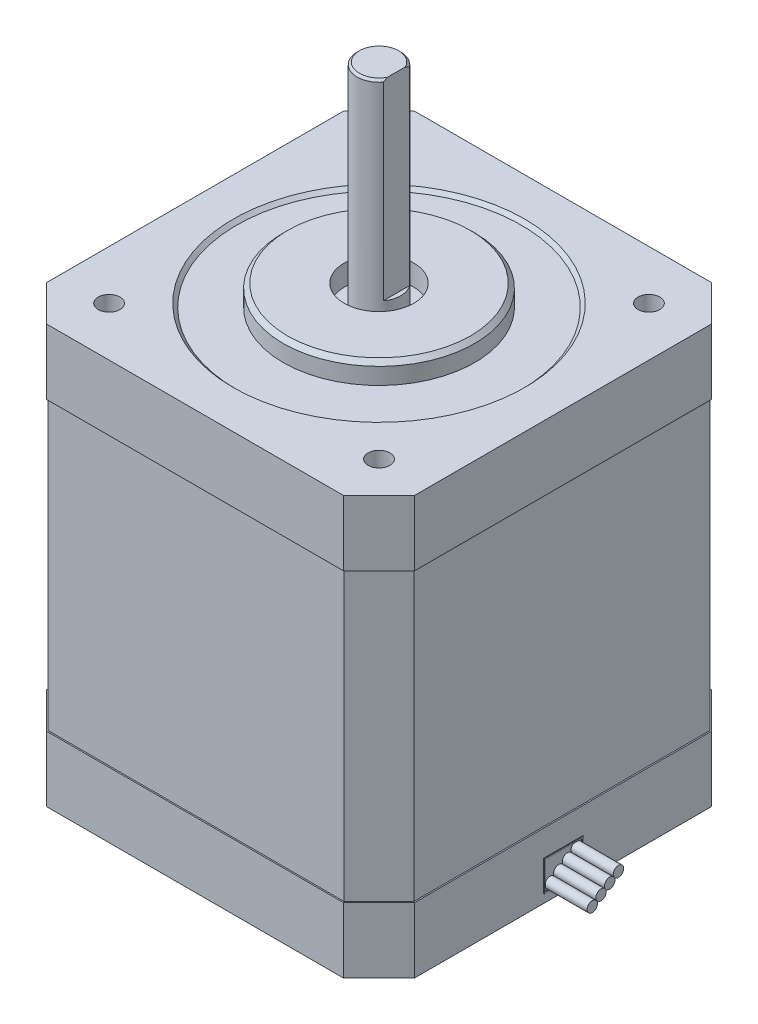
from build123d import *

# Parameters (mm, degrees)
CROQUIS1_W                          = 42
CROQUIS1_H                          = 42
SALIENTE_EXTRUIR1_DEPTH             = 48
CHAFL_N1_SIZE                       = 4
CROQUIS3_R                          = 16.25
CORTAR_EXTRUIR1_DEPTH               = 0.4
SALIENTE_EXTRUIR2_REACH             = 60.155
CROQUIS4_R                          = 11
CROQUIS4_R_2                        = 4
CHAFL_N2_SIZE                       = 0.5
CROQUIS5_R                          = 2.5
SALIENTE_EXTRUIR3_DEPTH             = 22
SALIENTE_EXTRUIR3_DIRECTION_2_REACH = 60.155
CORTAR_EXTRUIR2_DEPTH               = 22
CHAFL_N3_SIZE                       = 0.25
SALIENTE_EXTRUIR9_DEPTH             = 7.5
SALIENTE_EXTRUIR10_DEPTH            = 7.5
CROQUIS7_R                          = 1.25
CORTAR_EXTRUIR3_DEPTH               = 4.5
CROQUIS10_W                         = 4.5
CROQUIS10_H                         = 3.5
CROQUIS10_W_2                       = 4.2
CROQUIS10_H_2                       = 3.2
SALIENTE_EXTRUIR7_DEPTH             = 0.1
CROQUIS11_R                         = 0.600632734
SALIENTE_EXTRUIR8_DEPTH             = 5
SALIENTE_EXTRUIR8_2_DEPTH           = 5
SALIENTE_EXTRUIR8_3_DEPTH           = 5
SALIENTE_EXTRUIR8_4_DEPTH           = 5


with BuildPart() as part:
    # Croquis1 → Saliente-Extruir1 (new body)
    with BuildSketch(Plane(origin=(0, 0, 0), x_dir=(1, 0, 0), z_dir=(0, 1, 0))):
        Rectangle(CROQUIS1_W, CROQUIS1_H)
    extrude(amount=SALIENTE_EXTRUIR1_DEPTH)

    # Chaflán1
    chafl_n1_edges = [part.edges().sort_by_distance(p)[0] for p in [
        (-21, 24, -21),
        (21, 24, -21),
        (21, 24, 21),
        (-21, 24, 21),
    ]]
    chamfer(chafl_n1_edges, length=CHAFL_N1_SIZE)

    # Croquis3 → Cortar-Extruir1 (cut)
    with BuildSketch(Plane(origin=(0, 48, 0), x_dir=(1, 0, 0), z_dir=(0, 1, 0))):
        with Locations(Location((0, 0, 0), (0, 0, 270))):
            Circle(CROQUIS3_R)
    extrude(amount=-CORTAR_EXTRUIR1_DEPTH, mode=Mode.SUBTRACT)

    # Croquis4 → Saliente-Extruir2 (add, up to next)
    with BuildSketch(Plane(origin=(0, 50, 0), x_dir=(-1, 0, 0), z_dir=(0, -1, 0)), mode=Mode.PRIVATE) as saliente_extruir2_sk1:
        with Locations(Location((0, 0, 0), (0, 0, 270))):
            Circle(CROQUIS4_R)
        with Locations(Location((0, 0, 0), (0, 0, 270))):
            Circle(CROQUIS4_R_2, mode=Mode.SUBTRACT)
    saliente_extruir2_tool1 = extrude(saliente_extruir2_sk1.sketch, amount=SALIENTE_EXTRUIR2_REACH, mode=Mode.PRIVATE) - part.part
    add(saliente_extruir2_tool1.solids().sort_by_distance((0, 50, -10.688873))[0])

    # Chaflán2
    # the kernel refuses this chamfer: 0.5 mm, written as the material it takes off along each edge
    with BuildSketch(Plane(origin=(0, 48, 0), x_dir=(0, 0, 1), z_dir=(-1, 0, 0))) as chafl_n2_piece_1_section:
        Polygon((16.25 + CHAFL_N2_SIZE, 0), (16.25, -CHAFL_N2_SIZE), (16.25, 0), align=None)
    chafl_n2_piece_1 = revolve(axis=Axis((0, 48, 0), (0, 1, 0)), mode=Mode.PRIVATE)
    chafl_n2_piece_1 = split(chafl_n2_piece_1, bisect_by=Plane(origin=(0, 47.6, -16.540253215), z_dir=(0, 1, 0)), keep=Keep.TOP, mode=Mode.PRIVATE)
    add(chafl_n2_piece_1, mode=Mode.SUBTRACT)
    with BuildSketch(Plane(origin=(0, 50, 0), x_dir=(0, 0, 1), z_dir=(1, 0, 0))) as chafl_n2_piece_2:
        Polygon((11, CHAFL_N2_SIZE), (11 - CHAFL_N2_SIZE, 0), (11, 0), align=None)
    revolve(axis=Axis((0, 50, 0), (0, -1, 0)), mode=Mode.SUBTRACT)


with BuildPart() as body_2:
    # Croquis5 → Saliente-Extruir3 (new body)
    with BuildSketch(Plane(origin=(0, 50, 0), x_dir=(1, 0, 0), z_dir=(0, 1, 0))):
        with Locations(Location((0, 0, 0), (0, 0, 270))):
            Circle(CROQUIS5_R)
    extrude(amount=SALIENTE_EXTRUIR3_DEPTH)


    # Croquis5 → Saliente-Extruir3 direction 2 (add, up to next)
    with BuildSketch(Plane(origin=(0, 50, 0), x_dir=(1, 0, 0), z_dir=(0, 1, 0)), mode=Mode.PRIVATE) as saliente_extruir3_direction_2_sk1:
        with Locations(Location((0, 0, 0), (0, 0, 270))):
            Circle(CROQUIS5_R)
    saliente_extruir3_direction_2_tool1 = extrude(saliente_extruir3_direction_2_sk1.sketch, amount=-SALIENTE_EXTRUIR3_DIRECTION_2_REACH, mode=Mode.PRIVATE) - part.part
    add(saliente_extruir3_direction_2_tool1.solids().sort_by_distance((0, 50, 0))[0])

    # Croquis6 → Cortar-Extruir2 (cut)
    with BuildSketch(Plane(origin=(0, 72, 0), x_dir=(1, 0, 0), z_dir=(0, 1, 0))):
        with BuildLine():
            Line((2, 1.5), (2, -1.5))
            ThreePointArc((2, -1.5), (2.5, 0), (2, 1.5))
        make_face()
    extrude(amount=-CORTAR_EXTRUIR2_DEPTH, mode=Mode.SUBTRACT)

    # Chaflán3
    chafl_n3_edges = [body_2.edges().sort_by_distance(p)[0] for p in [
        (-2.236067977, 72, -1.118033989),
    ]]
    chamfer(chafl_n3_edges, length=CHAFL_N3_SIZE)


    add(part.part)  # Saliente-Extruir9 merges part
    # Croquis12 → Saliente-Extruir9 (add)
    with BuildSketch(Plane(origin=(0, 48, 0), x_dir=(1, 0, 0), z_dir=(0, 1, 0))):
        Polygon((-17.062132034, 21.15), (-21.15, 17.062132034), (-21.15, -17.062132034), (-17.062132034, -21.15), (17.062132034, -21.15), (21.15, -17.062132034), (21.15, 17.062132034), (17.062132034, 21.15), align=None)
        Polygon((-17, 21), (-21, 17), (-21, -17), (-17, -21), (17, -21), (21, -17), (21, 17), (17, 21), align=None, mode=Mode.SUBTRACT)
    extrude(amount=-SALIENTE_EXTRUIR9_DEPTH)

    # Croquis13 → Saliente-Extruir10 (add)
    with BuildSketch(Plane.XZ):
        Polygon((-17.062132034, -21.15), (-21.15, -17.062132034), (-21.15, 17.062132034), (-17.062132034, 21.15), (17.062132034, 21.15), (21.15, 17.062132034), (21.15, -17.062132034), (17.062132034, -21.15), align=None)
        Polygon((-17, -21), (-21, -17), (-21, 17), (-17, 21), (17, 21), (21, 17), (21, -17), (17, -21), align=None, mode=Mode.SUBTRACT)
    extrude(amount=-SALIENTE_EXTRUIR10_DEPTH)

    # Croquis7 → Cortar-Extruir3 (cut)
    with BuildSketch(Plane(origin=(0, 48, 0), x_dir=(1, 0, 0), z_dir=(0, 1, 0))):
        with Locations(Location((-15.5, 15.5, 0), (0, 0, 270))):
            Circle(CROQUIS7_R)
        with Locations(Location((15.5, 15.5, 0), (0, 0, 270))):
            Circle(CROQUIS7_R)
        with Locations(Location((15.5, -15.5, 0), (0, 0, 270))):
            Circle(CROQUIS7_R)
        with Locations(Location((-15.5, -15.5, 0), (0, 0, 270))):
            Circle(CROQUIS7_R)
    extrude(amount=-CORTAR_EXTRUIR3_DEPTH, mode=Mode.SUBTRACT)

    # Croquis10 → Saliente-Extruir7 (add)
    with BuildSketch(Plane(origin=(21.15, 0, 0), x_dir=(0, 0, -1), z_dir=(1, 0, 0))):
        with Locations((0, 2.75)):
            Rectangle(CROQUIS10_W, CROQUIS10_H)
        with Locations((0, 2.75)):
            Rectangle(CROQUIS10_W_2, CROQUIS10_H_2, mode=Mode.SUBTRACT)
    extrude(amount=SALIENTE_EXTRUIR7_DEPTH)


with BuildPart() as body_2_2:
    # Croquis11 → Saliente-Extruir8 (new body)
    with BuildSketch(Plane(origin=(21, 0, 0), x_dir=(0, 0, -1), z_dir=(1, 0, 0))):
        with Locations((-1.499367266, 1.750632734)):
            Circle(CROQUIS11_R)
    extrude(amount=SALIENTE_EXTRUIR8_DEPTH)


with BuildPart() as body_3:
    # Croquis11 → Saliente-Extruir8 2 (new body)
    with BuildSketch(Plane(origin=(21, 0, 0), x_dir=(0, 0, -1), z_dir=(1, 0, 0))):
        with Locations((-0.499789089, 2.416877578)):
            Circle(CROQUIS11_R)
    extrude(amount=SALIENTE_EXTRUIR8_2_DEPTH)


with BuildPart() as body_4:
    # Croquis11 → Saliente-Extruir8 3 (new body)
    with BuildSketch(Plane(origin=(21, 0, 0), x_dir=(0, 0, -1), z_dir=(1, 0, 0))):
        with Locations((0.499789089, 3.083122422)):
            Circle(CROQUIS11_R)
    extrude(amount=SALIENTE_EXTRUIR8_3_DEPTH)


with BuildPart() as body_5:
    # Croquis11 → Saliente-Extruir8 4 (new body)
    with BuildSketch(Plane(origin=(21, 0, 0), x_dir=(0, 0, -1), z_dir=(1, 0, 0))):
        with Locations((1.499367266, 3.749367266)):
            Circle(CROQUIS11_R)
    extrude(amount=SALIENTE_EXTRUIR8_4_DEPTH)


solid = Compound([body_2.part, body_2_2.part, body_3.part, body_4.part, body_5.part])
